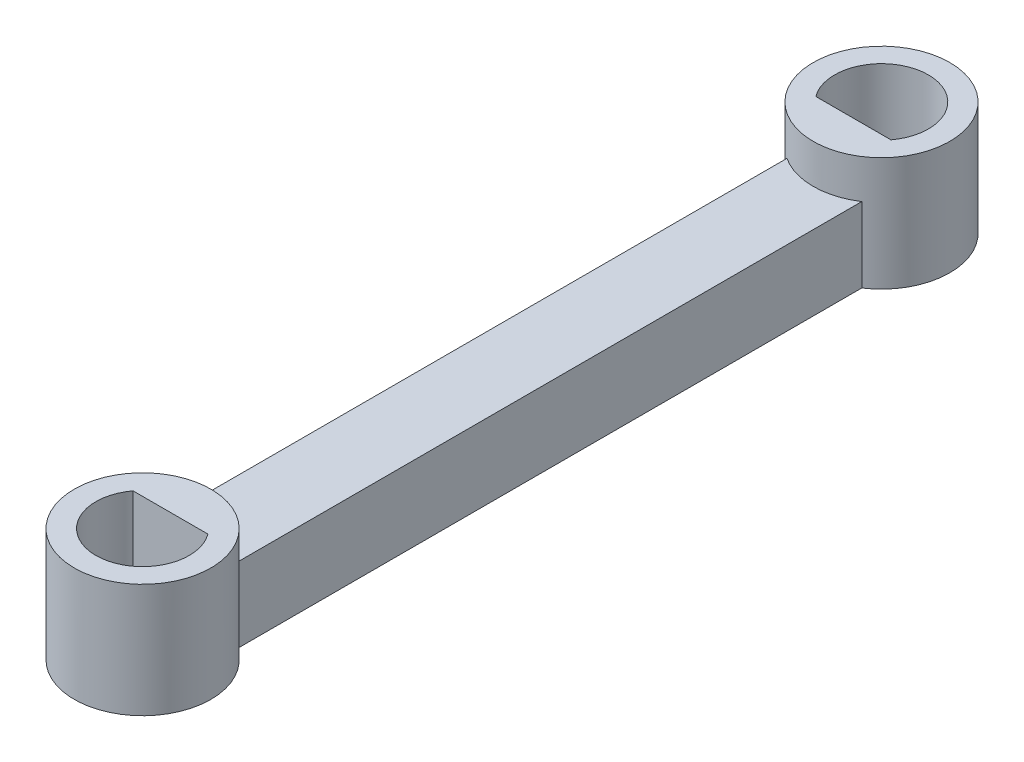
from build123d import *

# Parameters (mm, degrees)
SKETCH1_R           = 6
BOSS_EXTRUDE1_DEPTH = 10
SKETCH2_W           = 6.574952472
SKETCH2_H           = 6.574952471
BOSS_EXTRUDE2_DEPTH = 60
CUT_EXTRUDE1_DEPTH  = 72.85269654


with BuildPart() as part:
    # Sketch1 → Boss-Extrude1 (new body)
    with BuildSketch(Plane(origin=(0, 0, 0), x_dir=(1, 0, 0), z_dir=(0, 1, 0))):
        Circle(SKETCH1_R)
        with BuildLine():
            Line((-3.287476236, 2.45), (3.287476236, 2.45))
            ThreePointArc((3.287476236, 2.45), (0, -4.1), (-3.287476236, 2.45))
        make_face(mode=Mode.SUBTRACT)
    boss_extrude1 = extrude(amount=BOSS_EXTRUDE1_DEPTH)

    # Sketch2 → Boss-Extrude2 (add)
    with BuildSketch(Plane.XY.offset(-2.45)):
        with Locations((0, 3.287476236)):
            Rectangle(SKETCH2_W, SKETCH2_H)
    extrude(amount=-BOSS_EXTRUDE2_DEPTH)

    # Mirror1: Boss-Extrude1 across plane
    add(boss_extrude1.mirror(Plane(origin=(0, 0, -32.45), x_dir=(1, 0, 0), z_dir=(0, 0, -1))))

    # Sketch3 → Cut-Extrude1 (cut, through all)
    with BuildSketch(Plane(origin=(0, 10, 0), x_dir=(1, 0, 0), z_dir=(0, 1, 0))):
        with BuildLine():
            Line((-3.297499052, 62.43), (3.297499052, 62.43))
            ThreePointArc((3.297499052, 62.43), (0, 69.02), (-3.297499052, 62.43))
        make_face()
    extrude(amount=-CUT_EXTRUDE1_DEPTH, mode=Mode.SUBTRACT)


solid = part.part
